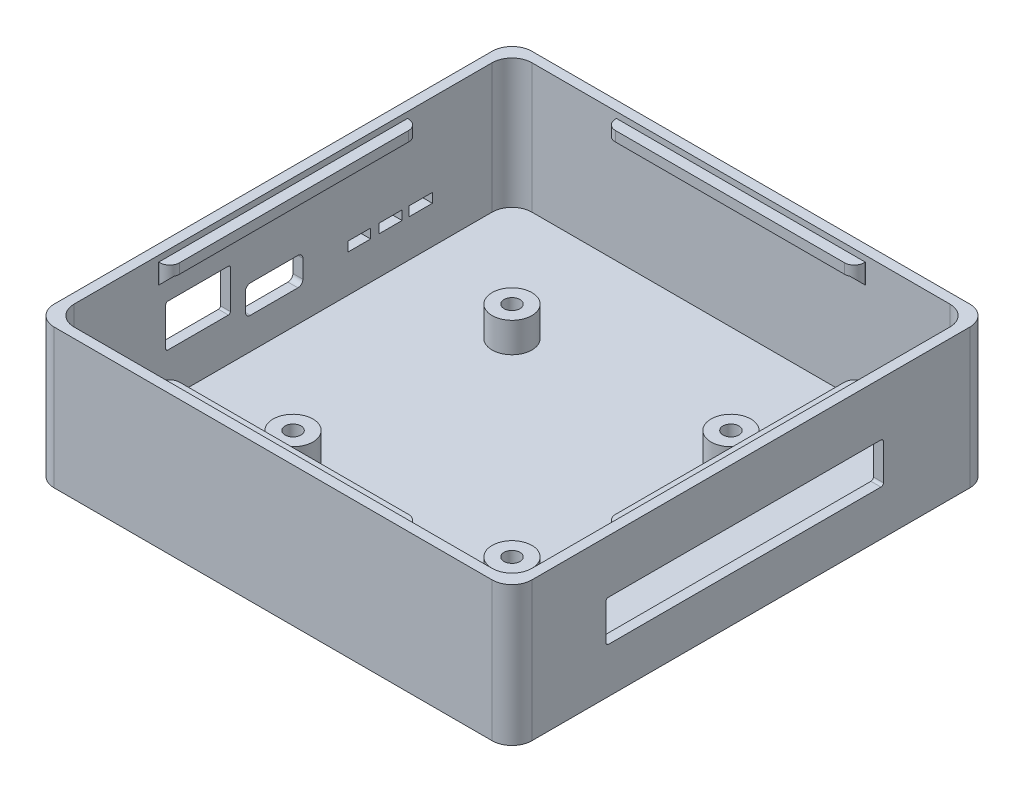
from build123d import *

# Parameters (mm, degrees)
SKETCH_1_W               = 96
SKETCH_1_H               = 96
EXTRUDE_1_DEPTH          = 28
SKETCH_3_W               = 92
SKETCH_3_H               = 92
CUT_EXTRUDE_1_DEPTH      = 26
FILLET_1_R               = 4
FILLET_2_R               = 4
SKETCH_4_R               = 4
EXTRUDE_2_DEPTH          = 6
SKETCH_5_R               = 1.6
CUT_EXTRUDE_2_DEPTH      = 8
SKETCH_6_W               = 12.999999928
SKETCH_6_H               = 8.49999995
SKETCH_6_W_2             = 4.700000191
SKETCH_6_H_2             = 1.900000077
SKETCH_6_W_3             = 4.600000187
SKETCH_6_H_3             = 1.849687021
SKETCH_6_W_4             = 4.500000183
SKETCH_6_W_5             = 11.544018717
SKETCH_6_H_4             = 5.642342208
CUT_EXTRUDE_3_DEPTH      = 2
FILLET_3_R               = 0.4
SKETCH_7_W               = 55.768080965
SKETCH_7_H               = 8.199999866
CUT_EXTRUDE_4_DEPTH      = 2
FILLET_4_R               = 0.5
FILLET_5_R               = 1
SKETCH_8_W               = 50
SKETCH_8_H               = 2
EXTRUDE_3_DEPTH          = 2.2
FILLET_6_R               = 2
PATTERN_CIRCULAR_1_COUNT = 4
FILLET_7_R               = 2
CHAMFER_START            = 23
CHAMFER_1_DEPTH          = 50
CHAMFER_START_2          = 22.8
CHAMFER_1_2_DEPTH        = 2
CHAMFER_2_DEPTH          = 50
CHAMFER_2_2_DEPTH        = 2
CHAMFER_3_DEPTH          = 50
CHAMFER_3_2_DEPTH        = 2
CHAMFER_4_DEPTH          = 50
CHAMFER_4_2_DEPTH        = 2


with BuildPart() as part:
    # 草图1 → 凸台-拉伸1 (new body)
    with BuildSketch(Plane(origin=(0, 0, 0), x_dir=(1, 0, 0), z_dir=(0, 1, 0))):
        with Locations((48, -48)):
            Rectangle(SKETCH_1_W, SKETCH_1_H)
    extrude(amount=EXTRUDE_1_DEPTH)

    # 草图3 → 切除-拉伸1 (cut)
    with BuildSketch(Plane(origin=(0, 28, 0), x_dir=(1, 0, 0), z_dir=(0, 1, 0))):
        with Locations((48, -48)):
            Rectangle(SKETCH_3_W, SKETCH_3_H)
    extrude(amount=-CUT_EXTRUDE_1_DEPTH, mode=Mode.SUBTRACT)

    # 圆角1
    fillet_1_edges = [part.edges().sort_by_distance(p)[0] for p in [
        (2, 15, 94),
        (2, 15, 2),
        (94, 15, 2),
        (94, 15, 94),
    ]]
    fillet(fillet_1_edges, radius=FILLET_1_R)

    # 圆角2
    fillet_2_edges = [part.edges().sort_by_distance(p)[0] for p in [
        (0, 14, 0),
        (96, 14, 0),
        (96, 14, 96),
        (0, 14, 96),
    ]]
    fillet(fillet_2_edges, radius=FILLET_2_R)

    # 草图4 → 凸台-拉伸2 (add)
    with BuildSketch(Plane(origin=(0, 2, 0), x_dir=(1, 0, 0), z_dir=(0, 1, 0))):
        with Locations(Location((26, -26, 0), (0, 0, 270))):
            Circle(SKETCH_4_R)
        with Locations(Location((70, -26, 0), (0, 0, 90))):
            Circle(SKETCH_4_R)
        with Locations(Location((70, -70, 0), (0, 0, 270))):
            Circle(SKETCH_4_R)
        with Locations(Location((26, -70, 0), (0, 0, 90))):
            Circle(SKETCH_4_R)
    extrude(amount=EXTRUDE_2_DEPTH)

    # 草图5 → 切除-拉伸2 (cut)
    with BuildSketch(Plane(origin=(0, 8, 0), x_dir=(1, 0, 0), z_dir=(0, 1, 0))):
        with Locations(Location((26, -26, 0), (0, 0, 270))):
            Circle(SKETCH_5_R)
        with Locations(Location((70, -26, 0), (0, 0, 270))):
            Circle(SKETCH_5_R)
        with Locations(Location((26, -70, 0), (0, 0, 270))):
            Circle(SKETCH_5_R)
        with Locations(Location((70, -70, 0), (0, 0, 270))):
            Circle(SKETCH_5_R)
    extrude(amount=-CUT_EXTRUDE_2_DEPTH, mode=Mode.SUBTRACT)

    # 草图6 → 切除-拉伸3 (cut)
    with BuildSketch(Plane.ZY):
        with Locations((65.087122174, 14.836156947)):
            Rectangle(SKETCH_6_W, SKETCH_6_H)
        with Locations((20.344696565, 10.485844036)):
            Rectangle(SKETCH_6_W_2, SKETCH_6_H_2)
        with Locations((26.390708755, 10.511000564)):
            Rectangle(SKETCH_6_W_3, SKETCH_6_H_3)
        with Locations((32.663721202, 10.485844036)):
            Rectangle(SKETCH_6_W_4, SKETCH_6_H_2)
        with Locations((49.799296419, 11.158551524)):
            Rectangle(SKETCH_6_W_5, SKETCH_6_H_4)
    extrude(amount=-CUT_EXTRUDE_3_DEPTH, mode=Mode.SUBTRACT)

    # 圆角3
    fillet_3_edges = [part.edges().sort_by_distance(p)[0] for p in [
        (1, 10.586156972, 58.58712221),
        (1, 19.086156922, 58.58712221),
        (1, 19.086156922, 71.587122138),
        (1, 10.586156972, 71.587122138),
    ]]
    fillet(fillet_3_edges, radius=FILLET_3_R)

    # 草图7 → 切除-拉伸4 (cut)
    with BuildSketch(Plane(origin=(96, 0, 0), x_dir=(0, 0, -1), z_dir=(1, 0, 0))):
        with Locations((-49.248086711, 13.186156826)):
            Rectangle(SKETCH_7_W, SKETCH_7_H)
    extrude(amount=-CUT_EXTRUDE_4_DEPTH, mode=Mode.SUBTRACT)

    # 圆角4
    fillet_4_edges = [part.edges().sort_by_distance(p)[0] for p in [
        (95, 9.086156893, 77.132127193),
        (95, 17.286156759, 77.132127193),
        (95, 17.286156759, 21.364046228),
        (95, 9.086156893, 21.364046228),
    ]]
    fillet(fillet_4_edges, radius=FILLET_4_R)

    # 圆角5
    fillet_5_edges = [part.edges().sort_by_distance(p)[0] for p in [
        (1, 8.33738042, 44.02728706),
        (1, 13.979722628, 44.02728706),
        (1, 13.979722628, 55.571305777),
        (1, 8.33738042, 55.571305777),
    ]]
    fillet(fillet_5_edges, radius=FILLET_5_R)

    # 草图8 → 凸台-拉伸3 (add)
    with BuildSketch(Plane(origin=(0, 0, 94), x_dir=(-1, 0, 0), z_dir=(0, 0, -1))):
        with Locations((-48, 25.8)):
            Rectangle(SKETCH_8_W, SKETCH_8_H)
    extrude_3 = extrude(amount=EXTRUDE_3_DEPTH)

    # 圆角6
    fillet_6_edges = [part.edges().sort_by_distance(p)[0] for p in [
        (73, 25.8, 91.8),
        (23, 25.8, 91.8),
    ]]
    fillet(fillet_6_edges, radius=FILLET_6_R)

    # 阵列(圆周)1: 凸台-拉伸3 ×4 about axis
    pattern_circular_1_axis = Axis((48, 0, 48), (0, 1, 0))
    for i in range(1, PATTERN_CIRCULAR_1_COUNT):
        add(extrude_3.rotate(pattern_circular_1_axis, i * 360 / PATTERN_CIRCULAR_1_COUNT))

    # 圆角7
    fillet_7_edges = [part.edges().sort_by_distance(p)[0] for p in [
        (91.8, 25.8, 23),
        (91.8, 25.8, 73),
        (23, 25.8, 4.2),
        (73, 25.8, 4.2),
        (4.2, 25.8, 73),
        (4.2, 25.8, 23),
    ]]
    fillet(fillet_7_edges, radius=FILLET_7_R)

    # 倒角1: read off the stored shape, not the designer's step
    # 倒角1 outline → 倒角1 (add)
    with BuildSketch(Plane.YZ.offset(CHAMFER_START)):
        Polygon((24.8, 2), (24.8, 4), (22.8, 2), align=None)
    extrude(amount=CHAMFER_1_DEPTH)

    # Chamfer 1 2 outline → Chamfer 1 2 (cut)
    with BuildSketch(Plane(origin=(0, 0, 0), x_dir=(1, 0, 0), z_dir=(0, 1, 0)).offset(CHAMFER_START_2)):
        with BuildLine():
            Line((73, -4.20000003), (73, -2.2))
            ThreePointArc((73, -2.2), (72.414213562, -3.614213562), (71, -4.2))
            Line((71, -4.2), (73, -4.20000003))
        make_face()
        with BuildLine():
            Line((23, -4.20000003), (25, -4.2))
            ThreePointArc((25, -4.2), (23.585786438, -3.614213562), (23, -2.2))
            Line((23, -2.2), (23, -4.20000003))
        make_face()
    extrude(amount=CHAMFER_1_2_DEPTH, mode=Mode.SUBTRACT)

    # 倒角2: read off the stored shape, not the designer's step
    # 倒角2 outline → 倒角2 (add)
    with BuildSketch(Plane.YZ.offset(CHAMFER_START)):
        Polygon((24.8, 94), (22.8, 94), (24.8, 92), align=None)
    extrude(amount=CHAMFER_2_DEPTH)

    # Chamfer 2 2 outline → Chamfer 2 2 (cut)
    with BuildSketch(Plane(origin=(0, 0, 0), x_dir=(1, 0, 0), z_dir=(0, 1, 0)).offset(CHAMFER_START_2)):
        with BuildLine():
            Line((23, -91.79999997), (23, -93.8))
            ThreePointArc((23, -93.8), (23.585786438, -92.385786438), (25, -91.8))
            Line((25, -91.8), (23, -91.79999997))
        make_face()
        with BuildLine():
            Line((73, -91.79999997), (71, -91.8))
            ThreePointArc((71, -91.8), (72.414213562, -92.385786438), (73, -93.8))
            Line((73, -93.8), (73, -91.79999997))
        make_face()
    extrude(amount=CHAMFER_2_2_DEPTH, mode=Mode.SUBTRACT)

    # 倒角3: read off the stored shape, not the designer's step
    # 倒角3 outline → 倒角3 (add)
    with BuildSketch(Plane.XY.offset(CHAMFER_START)):
        Polygon((94, 24.8), (92, 24.8), (94, 22.8), align=None)
    extrude(amount=CHAMFER_3_DEPTH)

    # Chamfer 3 2 outline → Chamfer 3 2 (cut)
    with BuildSketch(Plane(origin=(0, 0, 0), x_dir=(1, 0, 0), z_dir=(0, 1, 0)).offset(CHAMFER_START_2)):
        with BuildLine():
            Line((91.79999997, -73), (93.8, -73))
            ThreePointArc((93.8, -73), (92.385786438, -72.414213562), (91.8, -71))
            Line((91.8, -71), (91.79999997, -73))
        make_face()
        with BuildLine():
            Line((91.79999997, -23), (91.8, -25))
            ThreePointArc((91.8, -25), (92.385786438, -23.585786438), (93.8, -23))
            Line((93.8, -23), (91.79999997, -23))
        make_face()
    extrude(amount=CHAMFER_3_2_DEPTH, mode=Mode.SUBTRACT)

    # 倒角4: read off the stored shape, not the designer's step
    # 倒角4 outline → 倒角4 (add)
    with BuildSketch(Plane.XY.offset(CHAMFER_START)):
        Polygon((2, 24.8), (2, 22.8), (4, 24.8), align=None)
    extrude(amount=CHAMFER_4_DEPTH)

    # Chamfer 4 2 outline → Chamfer 4 2 (cut)
    with BuildSketch(Plane(origin=(0, 0, 0), x_dir=(1, 0, 0), z_dir=(0, 1, 0)).offset(CHAMFER_START_2)):
        with BuildLine():
            Line((4.20000003, -23), (2.2, -23))
            ThreePointArc((2.2, -23), (3.614213562, -23.585786438), (4.2, -25))
            Line((4.2, -25), (4.20000003, -23))
        make_face()
        with BuildLine():
            Line((4.200000031, -73), (4.2, -71))
            ThreePointArc((4.2, -71), (3.614213562, -72.414213562), (2.2, -73))
            Line((2.2, -73), (4.200000031, -73))
        make_face()
    extrude(amount=CHAMFER_4_2_DEPTH, mode=Mode.SUBTRACT)


solid = part.part
